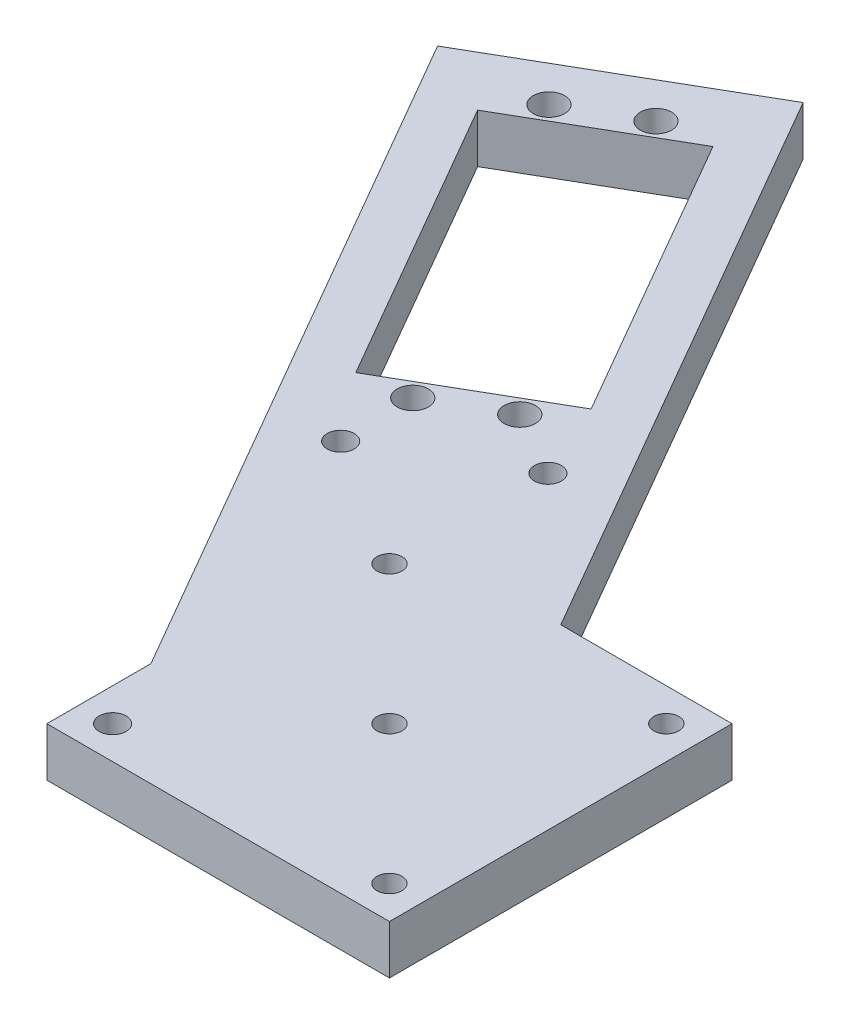
from build123d import *

# Parameters (mm, degrees)
SKETCH1_R           = 1.75
SKETCH1_R_2         = 1.625
SKETCH1_R_3         = 1.74995
BOSS_EXTRUDE1_DEPTH = 6.35
SKETCH2_R           = 2.032
CUT_EXTRUDE1_DEPTH  = 122.309718695


with BuildPart() as part:
    # Sketch1 → Boss-Extrude1 (new body)
    with BuildSketch(Plane(origin=(0, 0, 0), x_dir=(1, 0, 0), z_dir=(0, 1, 0))):
        Polygon((-22.09368868, -8.589760725), (-22.09368868, -22.09368868), (22.35631132, -22.09368868), (22.35631132, 22.35631132), (0.13131132, 22.35631132), (-42.824896411, 96.75864561), (-72.89368868, 79.3984203), align=None)
        with Locations((-17.829200922, -17.829200922)):
            Circle(SKETCH1_R, mode=Mode.SUBTRACT)
        with Locations((18.091823562, -17.829200922)):
            Circle(SKETCH1_R_2, mode=Mode.SUBTRACT)
        with Locations((0.13131132, 0.13131132)):
            Circle(SKETCH1_R_2, mode=Mode.SUBTRACT)
        with Locations((-17.829200922, 18.091823562)):
            Circle(SKETCH1_R_2, mode=Mode.SUBTRACT)
        with Locations((18.091823562, 18.091823562)):
            Circle(SKETCH1_R_2, mode=Mode.SUBTRACT)
        with Locations((-34.76828868, 28.70377132)):
            Circle(SKETCH1_R_3, mode=Mode.SUBTRACT)
        with Locations((-17.723762663, 38.544433004)):
            Circle(SKETCH1_R_3, mode=Mode.SUBTRACT)
    extrude(amount=BOSS_EXTRUDE1_DEPTH)

    # Sketch2 → Cut-Extrude1 (cut, through all)
    with BuildSketch(Plane.XZ):
        Polygon((-22.145592633, -48.57259018), (-41.502992458, -37.39659018), (-63.092992458, -74.791567115), (-43.735592633, -85.967567115), align=None)
        with Locations((-59.083701597, -80.039271641)):
            Circle(SKETCH2_R)
        with Locations((-50.284883494, -85.119271641)):
            Circle(SKETCH2_R)
        with Locations((-26.154883494, -43.324885654)):
            Circle(SKETCH2_R)
        with Locations((-34.953701597, -38.244885654)):
            Circle(SKETCH2_R)
    extrude(amount=-CUT_EXTRUDE1_DEPTH, mode=Mode.SUBTRACT)


solid = part.part
